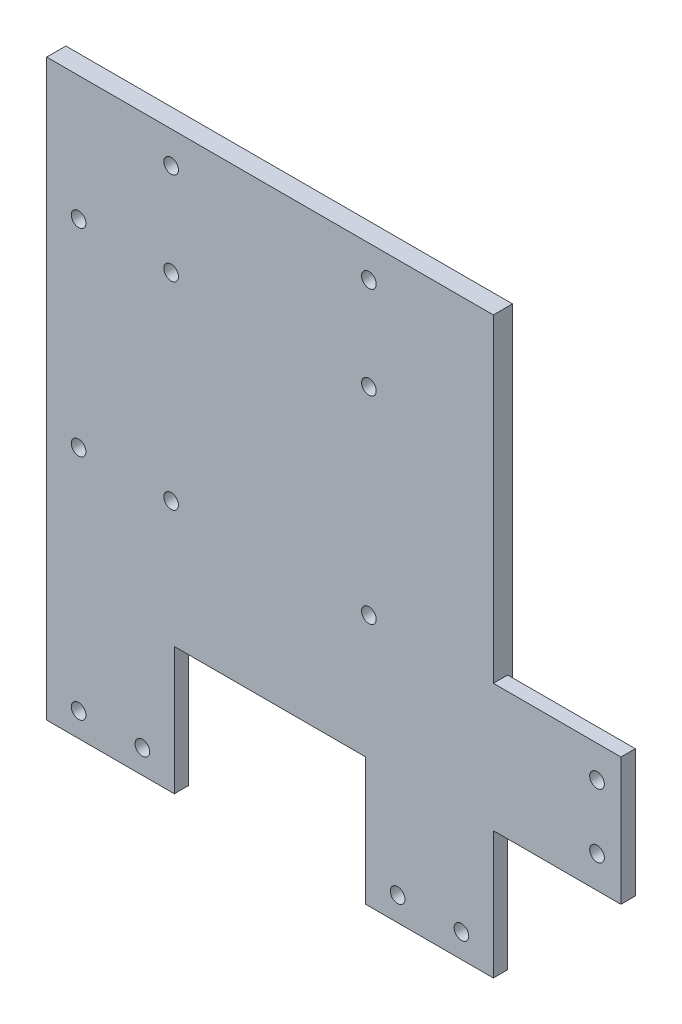
from build123d import *

# Parameters (mm, degrees)
SKETCH1_W           = 140
SKETCH1_H           = 140
SKETCH1_R           = 2.3
BOSS_EXTRUDE1_DEPTH = 6
SKETCH2_W           = 40
SKETCH2_H           = 40
SKETCH2_R           = 2.3
BOSS_EXTRUDE2_DEPTH = 4.5


with BuildPart() as part:
    # Sketch1 → Boss-Extrude1 (new body)
    with BuildSketch(Plane(origin=(0, 0, -16.6), x_dir=(1, 0, 0), z_dir=(0, 0, -1))):
        Rectangle(SKETCH1_W, SKETCH1_H)
        with Locations((-31, -31)):
            Circle(SKETCH1_R, mode=Mode.SUBTRACT)
        with Locations((-31, 31)):
            Circle(SKETCH1_R, mode=Mode.SUBTRACT)
        with Locations((31, 31)):
            Circle(SKETCH1_R, mode=Mode.SUBTRACT)
        with Locations((31, -31)):
            Circle(SKETCH1_R, mode=Mode.SUBTRACT)
        with Locations((-31, -60)):
            Circle(SKETCH1_R, mode=Mode.SUBTRACT)
        with Locations((31, -60)):
            Circle(SKETCH1_R, mode=Mode.SUBTRACT)
        with Locations((-60, 31)):
            Circle(SKETCH1_R, mode=Mode.SUBTRACT)
        with Locations((-60, -31)):
            Circle(SKETCH1_R, mode=Mode.SUBTRACT)
    extrude(amount=BOSS_EXTRUDE1_DEPTH)

    # Sketch2 → Boss-Extrude2 (add)
    # profile 1 of 3: a face of its own
    with BuildSketch(Plane.XY.offset(-16.6)):
        with Locations((90, -50)):
            Rectangle(SKETCH2_W, SKETCH2_H)
        with Locations((102.5, -60)):
            Circle(SKETCH2_R, mode=Mode.SUBTRACT)
        with Locations((102.5, -40)):
            Circle(SKETCH2_R, mode=Mode.SUBTRACT)
    # profile 2 of 3: a face of its own
    with BuildSketch(Plane.XY.offset(-16.6)):
        with Locations((50, -90)):
            Rectangle(SKETCH2_W, SKETCH2_H)
        with Locations((40, -102.5)):
            Circle(SKETCH2_R, mode=Mode.SUBTRACT)
        with Locations((60, -102.5)):
            Circle(SKETCH2_R, mode=Mode.SUBTRACT)
    # profile 3 of 3: a face of its own
    with BuildSketch(Plane.XY.offset(-16.6)):
        with Locations((-50, -90)):
            Rectangle(SKETCH2_W, SKETCH2_H)
        with Locations((-60, -102.5)):
            Circle(SKETCH2_R, mode=Mode.SUBTRACT)
        with Locations((-40, -102.5)):
            Circle(SKETCH2_R, mode=Mode.SUBTRACT)
    extrude(amount=-BOSS_EXTRUDE2_DEPTH)


solid = part.part
